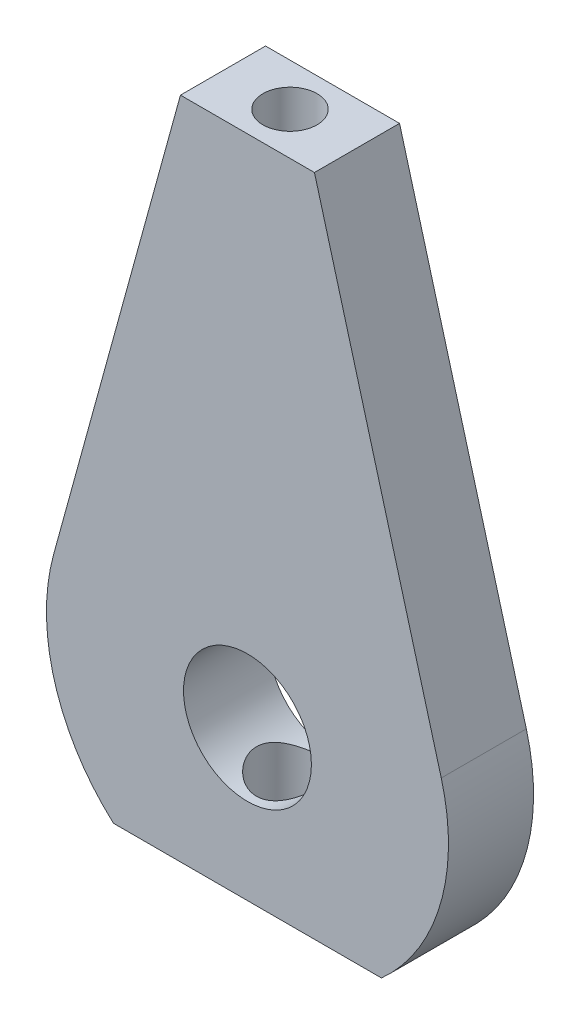
from build123d import *

# Parameters (mm, degrees)
BASE_DEPTH           = 3.175
SKETCH2_R            = 4.77266
SHAFT_AND_BOLT_DEPTH = 42.693487501
SET_SCREW_REACH      = 53.878
SKETCH3_R            = 2.5
SKETCH5_R            = 2.0193
CUT_EXTRUDE1_DEPTH   = 19.05


with BuildPart() as part:
    # Sketch1 → Base (new, symmetric)
    with BuildSketch(Plane.XY):
        with BuildLine():
            Line((-5, 38.38), (-14.46282813, 3.978266268))
            ThreePointArc((-14.46282813, 3.978266268), (-14.389347628, -4.236351595), (-10, -11.180339887))
            Line((-10, -11.180339887), (10, -11.180339887))
            ThreePointArc((10, -11.180339887), (14.389347628, -4.236351595), (14.46282813, 3.978266268))
            Line((14.46282813, 3.978266268), (5, 38.38))
            Line((5, 38.38), (-5, 38.38))
        make_face()
    extrude(amount=BASE_DEPTH, both=True)

    # Sketch2 → Shaft and Bolt (cut, through all)
    with BuildSketch(Plane.XY.offset(3.175)):
        Circle(SKETCH2_R)
    extrude(amount=-SHAFT_AND_BOLT_DEPTH, mode=Mode.SUBTRACT)

    # Sketch3 → Set Screw (cut, up to next)
    with BuildSketch(Plane.XZ.offset(11.180339887), mode=Mode.PRIVATE) as set_screw_sk1:
        Circle(SKETCH3_R)
    set_screw_tool1 = extrude(set_screw_sk1.sketch, amount=-SET_SCREW_REACH, mode=Mode.PRIVATE) & part.part
    add(set_screw_tool1.solids().sort_by_distance((0, -11.18034, 0))[0], mode=Mode.SUBTRACT)

    # Sketch5 → Cut-Extrude1 (cut)
    with BuildSketch(Plane(origin=(0, 38.38, 0), x_dir=(1, 0, 0), z_dir=(0, 1, 0))):
        Circle(SKETCH5_R)
    extrude(amount=-CUT_EXTRUDE1_DEPTH, mode=Mode.SUBTRACT)


solid = part.part
